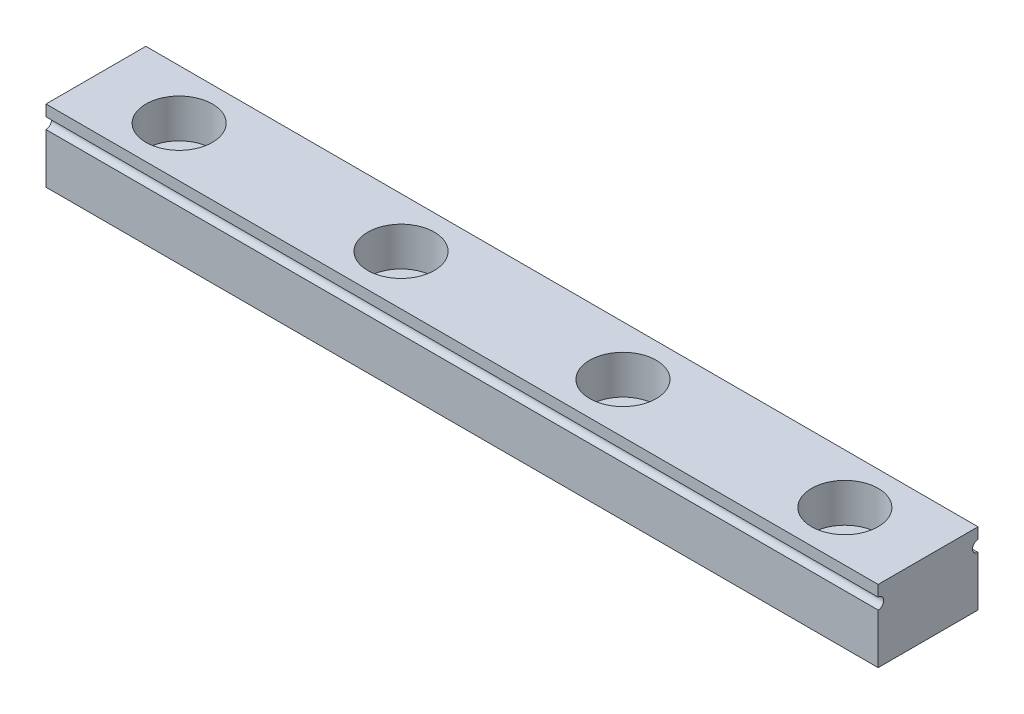
from build123d import *

# Parameters (mm, degrees)
IT_IS_6_5MM_DONT_FUCKIN_CHANGE_DEPTH = 75
SKETCH2_R                            = 1.5
CUT_EXTRUDE1_DEPTH                   = 76.415515645
SKETCH3_R                            = 3
CUT_EXTRUDE2_DEPTH                   = 3.5


with BuildPart() as part:
    # Sketch1 → it is 6.5mm, dont fuckin change (new body)
    with BuildSketch(Plane(origin=(0, 0, 0), x_dir=(0, 0, -1), z_dir=(1, 0, 0))):
        with BuildLine():
            Line((4.5, 3.25), (-4.5, 3.25))
            Line((-4.5, 3.25), (-4.5, 2.25))
            ThreePointArc((-4.5, 2.25), (-4.146446609, 2.103553391), (-4, 1.75))
            ThreePointArc((-4, 1.75), (-4.146446609, 1.396446609), (-4.5, 1.25))
            Line((-4.5, 1.25), (-4.5, -3.25))
            Line((-4.5, -3.25), (4.5, -3.25))
            Line((4.5, -3.25), (4.5, 1.25))
            ThreePointArc((4.5, 1.25), (4, 1.75), (4.5, 2.25))
            Line((4.5, 2.25), (4.5, 3.25))
        make_face()
    extrude(amount=IT_IS_6_5MM_DONT_FUCKIN_CHANGE_DEPTH)

    # Sketch2 → Cut-Extrude1 (cut, through all)
    with BuildSketch(Plane(origin=(0, 3.25, 0), x_dir=(1, 0, 0), z_dir=(0, 1, 0))):
        with Locations((7.5, 0)):
            Circle(SKETCH2_R)
        with Locations((27.5, 0)):
            Circle(SKETCH2_R)
        with Locations((47.5, 0)):
            Circle(SKETCH2_R)
        with Locations((67.5, 0)):
            Circle(SKETCH2_R)
    extrude(amount=-CUT_EXTRUDE1_DEPTH, mode=Mode.SUBTRACT)

    # Sketch3 → Cut-Extrude2 (cut)
    with BuildSketch(Plane(origin=(0, 3.25, 0), x_dir=(1, 0, 0), z_dir=(0, 1, 0))):
        with Locations((7.5, 0)):
            Circle(SKETCH3_R)
        with Locations((27.5, 0)):
            Circle(SKETCH3_R)
        with Locations((47.5, 0)):
            Circle(SKETCH3_R)
        with Locations((67.5, 0)):
            Circle(SKETCH3_R)
    extrude(amount=-CUT_EXTRUDE2_DEPTH, mode=Mode.SUBTRACT)


solid = part.part
